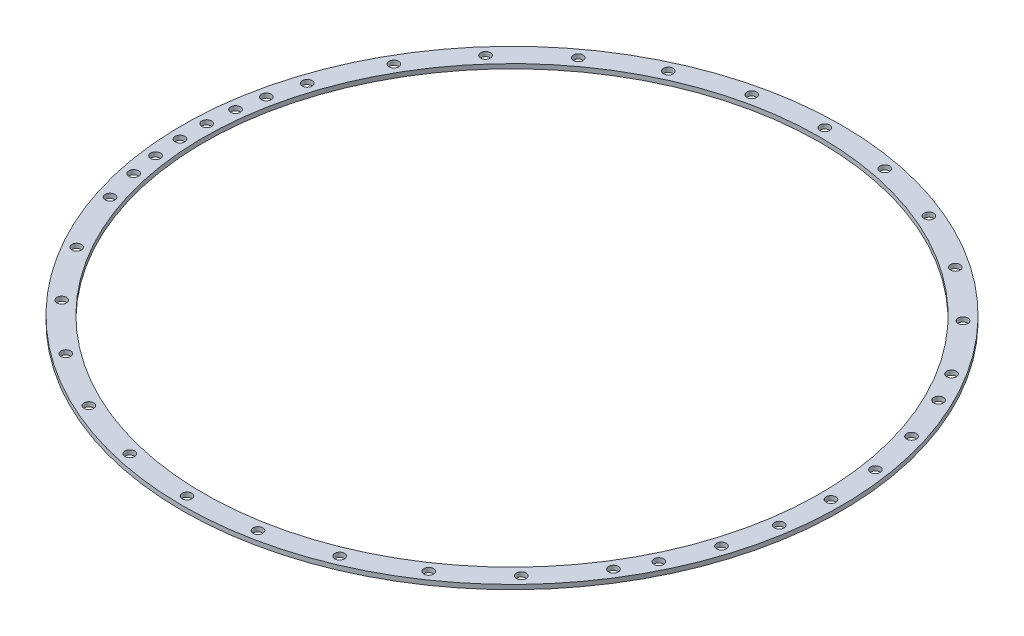
from build123d import *

# Parameters (mm, degrees)
SKETCH1_W          = 7
SKETCH1_H          = 1.5
SKETCH3_R          = 1.6
CUT_EXTRUDE2_DEPTH = 155.156576246


with BuildPart() as part:
    # Sketch1 → Revolve1 (revolve)
    with BuildSketch(Plane.XY):
        with Locations((-105.5, 3.925)):
            Rectangle(SKETCH1_W, SKETCH1_H)
    revolve(axis=Axis((0, -200069.047495165, 0), (0, 1, 0)))

    # Sketch3 → Cut-Extrude2 (cut, through all)
    with BuildSketch(Plane(origin=(0, 4.675, 0), x_dir=(1, 0, 0), z_dir=(0, 1, 0))):
        with Locations((-103.194571877, -21.934683381)):
            Circle(SKETCH3_R)
        with Locations((-105.407458575, -4.417881468)):
            Circle(SKETCH3_R)
        with Locations((-104.668100989, -13.222656141)):
            Circle(SKETCH3_R)
        with Locations((-100.336462469, 32.601292907)):
            Circle(SKETCH3_R)
        with Locations((104.295371407, 15.897342642)):
            Circle(SKETCH3_R)
        with Locations((100.708995202, 31.43164465)):
            Circle(SKETCH3_R)
        with Locations((94.822771885, 46.248155986)):
            Circle(SKETCH3_R)
        with Locations((-103.194571877, 21.934683381)):
            Circle(SKETCH3_R)
        with Locations((-104.668100989, 13.222656141)):
            Circle(SKETCH3_R)
        with Locations((-105.407458575, 4.417881468)):
            Circle(SKETCH3_R)
        with Locations((89.469074145, -55.906482377)):
            Circle(SKETCH3_R)
        with Locations((-44.130594647, 95.826617472)):
            Circle(SKETCH3_R)
        with Locations((-62.82106423, 84.757087545)):
            Circle(SKETCH3_R)
        with Locations((-78.848228037, 70.094271773)):
            Circle(SKETCH3_R)
        with Locations((-91.532612735, 52.45980181)):
            Circle(SKETCH3_R)
        with Locations((94.822771885, -46.248155986)):
            Circle(SKETCH3_R)
        with Locations((100.708995202, -31.43164465)):
            Circle(SKETCH3_R)
        with Locations((104.295371407, -15.897342642)):
            Circle(SKETCH3_R)
        with Locations((105.5, 0)):
            Circle(SKETCH3_R)
        with Locations((76.122528254, -73.04526468)):
            Circle(SKETCH3_R)
        with Locations((89.469074145, 55.906482377)):
            Circle(SKETCH3_R)
        with Locations((76.122528254, 73.04526468)):
            Circle(SKETCH3_R)
        with Locations((59.54875959, 87.08728513)):
            Circle(SKETCH3_R)
        with Locations((40.450414858, 97.437230758)):
            Circle(SKETCH3_R)
        with Locations((19.637170436, 103.656314507)):
            Circle(SKETCH3_R)
        with Locations((-2.008593938, 105.480877653)):
            Circle(SKETCH3_R)
        with Locations((-23.569203757, 102.833567643)):
            Circle(SKETCH3_R)
        with Locations((-91.532612735, -52.45980181)):
            Circle(SKETCH3_R)
        with Locations((-62.82106423, -84.757087545)):
            Circle(SKETCH3_R)
        with Locations((-44.130594647, -95.826617472)):
            Circle(SKETCH3_R)
        with Locations((-23.569203757, -102.833567643)):
            Circle(SKETCH3_R)
        with Locations((-2.008593938, -105.480877653)):
            Circle(SKETCH3_R)
        with Locations((19.637170436, -103.656314507)):
            Circle(SKETCH3_R)
        with Locations((40.450414858, -97.437230758)):
            Circle(SKETCH3_R)
        with Locations((59.54875959, -87.08728513)):
            Circle(SKETCH3_R)
        with Locations((-78.848228037, -70.094271773)):
            Circle(SKETCH3_R)
        with Locations((-100.336462469, -32.601292907)):
            Circle(SKETCH3_R)
    extrude(amount=-CUT_EXTRUDE2_DEPTH, mode=Mode.SUBTRACT)


solid = part.part
